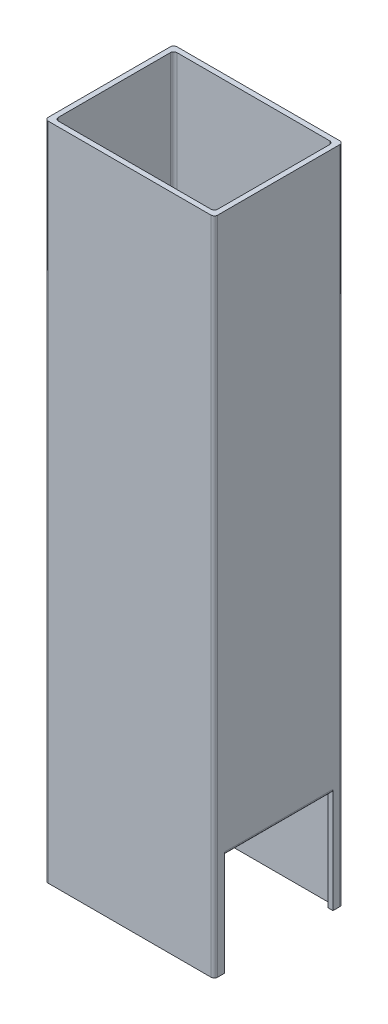
from build123d import *

# Parameters (mm, degrees)
SKETCH1_W               = 100
SKETCH1_H               = 76
SKETCH1_W_2             = 94
SKETCH1_H_2             = 70
BOSS_EXTRUDE1_DEPTH     = 389.5
CUT_EXTRUDE1_DEPTH      = 395.530417078
CUT_EXTRUDE1_DEPTH_BACK = 395.530417078
SKETCH4_W               = 64
SKETCH4_H               = 60
FILLET1_R               = 2


with BuildPart() as part:
    # Sketch1 → Boss-Extrude1 (new body)
    with BuildSketch(Plane(origin=(0, 0, 0), x_dir=(1, 0, 0), z_dir=(0, 1, 0))):
        Rectangle(SKETCH1_W, SKETCH1_H)
        Rectangle(SKETCH1_W_2, SKETCH1_H_2, mode=Mode.SUBTRACT)
    extrude(amount=BOSS_EXTRUDE1_DEPTH)

    # Sketch4 → Cut-Extrude1 (cut, two sides: drawn at the far end of the back side and taken through both)
    with BuildSketch(Plane(origin=(0, 0, 0), x_dir=(0, 0, -1), z_dir=(1, 0, 0)).offset(-CUT_EXTRUDE1_DEPTH_BACK)):
        with Locations((0, 30)):
            Rectangle(SKETCH4_W, SKETCH4_H)
    extrude(amount=CUT_EXTRUDE1_DEPTH + CUT_EXTRUDE1_DEPTH_BACK, mode=Mode.SUBTRACT)

    # Fillet1
    # the kernel refuses this fillet: 2 mm, written as the material it adds along each edge
    with BuildSketch(Plane(origin=(47, 0, 35), x_dir=(0, 0, -1), z_dir=(0, 1, 0))) as fillet1_piece_1:
        with BuildLine():
            CenterArc((FILLET1_R, FILLET1_R), FILLET1_R, 180, 90)
            Line((0, FILLET1_R), (0, 0))
            Line((0, 0), (FILLET1_R, 0))
        make_face()
    extrude(amount=389.5)
    with BuildSketch(Plane(origin=(-47, 0, 35), x_dir=(0, 0, -1), z_dir=(0, 1, 0)), Plane(origin=(47, 0, -35), x_dir=(0, 0, 1), z_dir=(0, 1, 0)), Plane(origin=(-47, 0, -35), x_dir=(1, 0, 0), z_dir=(0, 1, 0))) as fillet1_piece_2:
        with BuildLine():
            CenterArc((FILLET1_R, -FILLET1_R), FILLET1_R, 90, 90)
            Line((0, -FILLET1_R), (0, 0))
            Line((0, 0), (FILLET1_R, 0))
        make_face()
    extrude(amount=389.5)
    # the kernel refuses this fillet: 2 mm, written as the material it takes off along each edge
    with BuildSketch(Plane(origin=(50, -5, -38), x_dir=(-1, 0, 0), z_dir=(0, 1, 0)), Plane(origin=(-50, -5, -38), x_dir=(0, 0, 1), z_dir=(0, 1, 0))) as fillet1_2_piece_1:
        with BuildLine():
            CenterArc((FILLET1_R, FILLET1_R), FILLET1_R, 180, 90)
            Line((0, FILLET1_R), (0, 0))
            Line((0, 0), (FILLET1_R, 0))
        make_face()
    extrude(amount=399.5, mode=Mode.SUBTRACT)
    with BuildSketch(Plane(origin=(-50, -5, 38), x_dir=(0, 0, -1), z_dir=(0, 1, 0)), Plane(origin=(50, -5, 38), x_dir=(-1, 0, 0), z_dir=(0, 1, 0))) as fillet1_2_piece_2:
        with BuildLine():
            CenterArc((FILLET1_R, -FILLET1_R), FILLET1_R, 90, 90)
            Line((0, -FILLET1_R), (0, 0))
            Line((0, 0), (FILLET1_R, 0))
        make_face()
    extrude(amount=399.5, mode=Mode.SUBTRACT)
    with BuildSketch(Plane(origin=(-50, 60, 32), x_dir=(0, 1, 0), z_dir=(0, 0, -1)), Plane(origin=(50, 60, -32), x_dir=(0, 1, 0), z_dir=(0, 0, 1)), Plane(origin=(47, 60, 32), x_dir=(0, 1, 0), z_dir=(0, 0, -1))) as fillet1_2_piece_3:
        with BuildLine():
            CenterArc((FILLET1_R, FILLET1_R), FILLET1_R, 180, 90)
            Line((0, FILLET1_R), (0, 0))
            Line((0, 0), (FILLET1_R, 0))
        make_face()
    extrude(amount=64, mode=Mode.SUBTRACT)
    with BuildSketch(Plane(origin=(-47, 60, -32), x_dir=(-1, 0, 0), z_dir=(0, 0, 1))) as fillet1_2_piece_4:
        with BuildLine():
            CenterArc((FILLET1_R, -FILLET1_R), FILLET1_R, 90, 90)
            Line((0, -FILLET1_R), (0, 0))
            Line((0, 0), (FILLET1_R, 0))
        make_face()
    extrude(amount=64, mode=Mode.SUBTRACT)


solid = part.part
